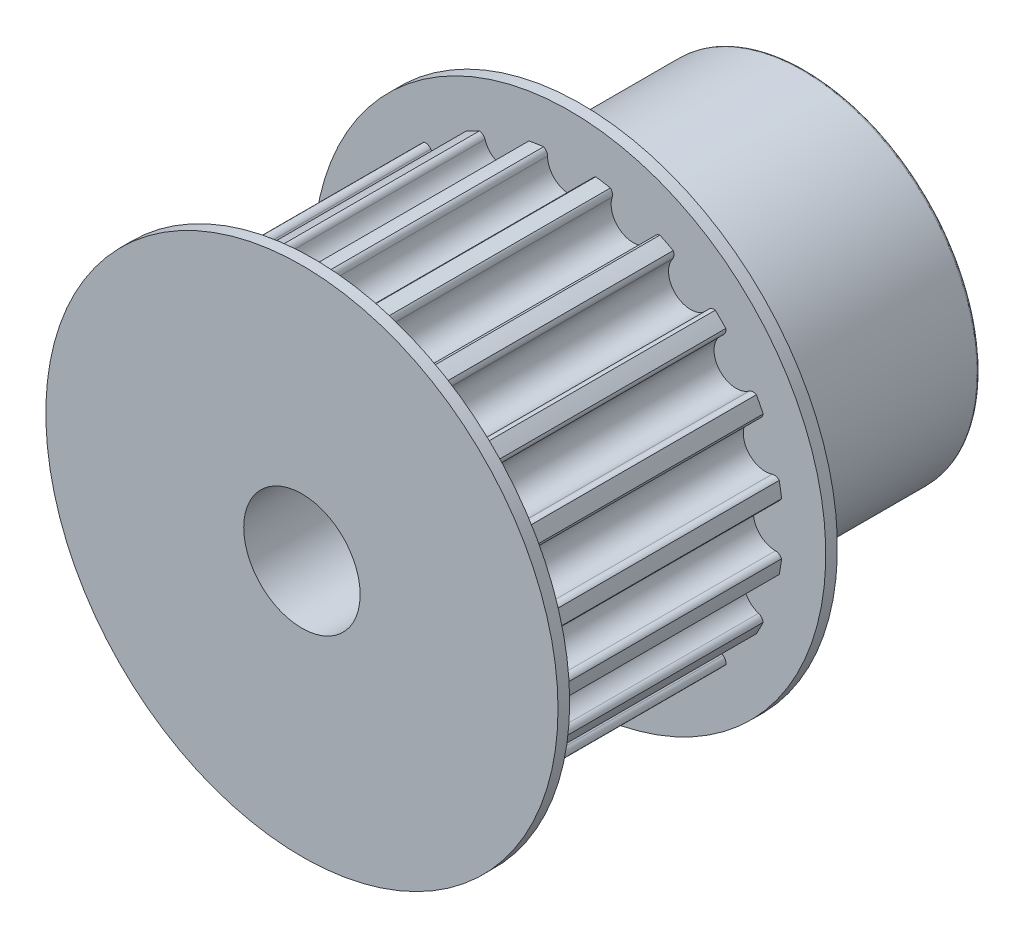
from build123d import *

# Parameters (mm, degrees)
SKETCH_1_R               = 9.17
EXTRUDE_1_DEPTH          = 11
CUT_EXTRUDE_1_REACH      = 19.005
PATTERN_CIRCULAR_1_COUNT = 20
SKETCH_3_R               = 11
EXTRUDE_2_DEPTH          = 0.5
EXTRUDE_START            = 0.5
SKETCH_4_R               = 11
EXTRUDE_3_DEPTH          = 0.5
SKETCH_5_R               = 7.5
EXTRUDE_4_DEPTH          = 10
CUT_EXTRUDE_2_REACH      = 28.944
SKETCH_6_R               = 2.5
FILLET_1_SIZE            = 0.5
FILLET_1_SIZE_2          = 3


with BuildPart() as part:
    # 草圖1 → 填料-伸長1 (new body)
    with BuildSketch(Plane.XY):
        Circle(SKETCH_1_R)
    extrude(amount=EXTRUDE_1_DEPTH)

    # 草圖2 → 除料-伸長1 (cut, up to next)
    with BuildSketch(Plane.XY.offset(11), mode=Mode.PRIVATE) as cut_extrude_1_sk1:
        with BuildLine():
            ThreePointArc((-1.117541879, 9.101648211), (0, 9.17), (1.117541879, 9.101648211))
            ThreePointArc((1.117541879, 9.101648211), (0.997261135, 8.994202524), (0.95, 8.84))
            ThreePointArc((0.95, 8.84), (0, 7.89), (-0.95, 8.84))
            ThreePointArc((-0.95, 8.84), (-0.997261135, 8.994202524), (-1.117541879, 9.101648211))
        make_face()
    cut_extrude_1_tool1 = extrude(cut_extrude_1_sk1.sketch, amount=-CUT_EXTRUDE_1_REACH, mode=Mode.PRIVATE) & part.part
    cut_extrude_1 = cut_extrude_1_tool1.solids().sort_by_distance((0, 8.608887, 11))[0]
    add(cut_extrude_1, mode=Mode.SUBTRACT)

    # 環狀複製排列1: 除料-伸長1 ×20 about axis
    pattern_circular_1_axis = Axis((0, 0, 0), (0, 0, 1))
    for i in range(1, PATTERN_CIRCULAR_1_COUNT):
        add(cut_extrude_1.rotate(pattern_circular_1_axis, i * 360 / PATTERN_CIRCULAR_1_COUNT), mode=Mode.SUBTRACT)

    # 草圖3 → 填料-伸長2 (add)
    with BuildSketch(Plane.XY.offset(11)):
        Circle(SKETCH_3_R)
    extrude(amount=EXTRUDE_2_DEPTH)

    # 草圖4 → 填料-伸長3 (add)
    with BuildSketch(Plane(origin=(0, 0, 0), x_dir=(-1, 0, 0), z_dir=(0, 0, -1)).offset(EXTRUDE_START)):
        with Locations(Location((0, 0, 0), (0, 0, 180))):
            Circle(SKETCH_4_R)
    extrude(amount=-EXTRUDE_3_DEPTH)

    # 草圖5 → 填料-伸長4 (add)
    with BuildSketch(Plane(origin=(0, 0, -0.5), x_dir=(-1, 0, 0), z_dir=(0, 0, -1))):
        Circle(SKETCH_5_R)
    extrude(amount=EXTRUDE_4_DEPTH)

    # 草圖6 → 除料-伸長2 (cut, up to next)
    with BuildSketch(Plane(origin=(0, 0, -10.5), x_dir=(-1, 0, 0), z_dir=(0, 0, -1)), mode=Mode.PRIVATE) as cut_extrude_2_sk1:
        Circle(SKETCH_6_R)
    cut_extrude_2_tool1 = extrude(cut_extrude_2_sk1.sketch, amount=-CUT_EXTRUDE_2_REACH, mode=Mode.PRIVATE) & part.part
    add(cut_extrude_2_tool1.solids().sort_by_distance((0, 0, -10.5))[0], mode=Mode.SUBTRACT)

    # 圓角1
    # an asymmetric fillet: 3, 0.5 mm, written as the material it takes off along each edge
    with BuildSketch(Plane(origin=(0, 0, -10.5), x_dir=(-1, 0, 0), z_dir=(0, -1, 0))) as fillet_1_piece_1:
        with BuildLine():
            Bezier((7.5, -FILLET_1_SIZE), (7.5, 0), (7.5 - FILLET_1_SIZE_2, 0), weights=[1, 0.707106781, 1])
            Line((7.5 - FILLET_1_SIZE_2, 0), (7.5, 0))
            Line((7.5, 0), (7.5, -FILLET_1_SIZE))
        make_face()
    revolve(axis=Axis((0, 0, -10.5), (0, 0, -1)), mode=Mode.SUBTRACT)


solid = part.part
